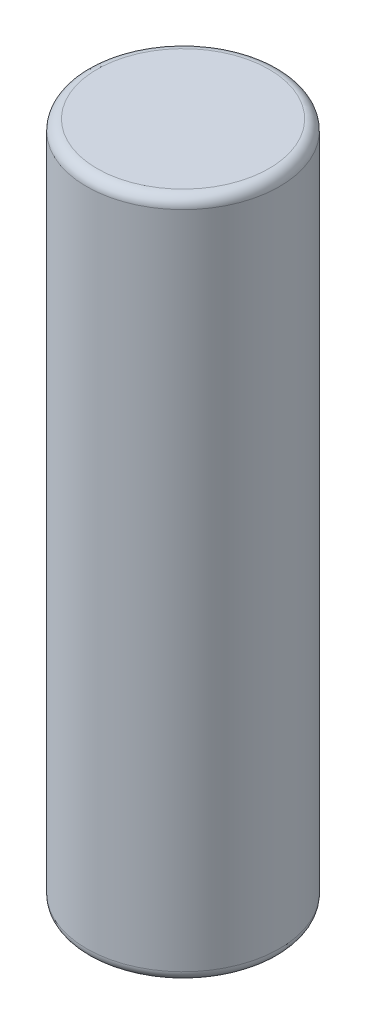
from build123d import *

# Parameters (mm, degrees)
SKETCH_1_R      = 9.25
EXTRUDE_1_DEPTH = 32.65
FILLET_1_R      = 1


with BuildPart() as part:
    # 스케치1 → 보스-돌출1 (new, symmetric)
    with BuildSketch(Plane(origin=(0, 0, 0), x_dir=(1, 0, 0), z_dir=(0, 1, 0))):
        Circle(SKETCH_1_R)
    extrude(amount=EXTRUDE_1_DEPTH, both=True)

    # 필렛1
    fillet_1_edges = [part.edges().sort_by_distance(p)[0] for p in [
        (-9.25, -32.65, 0),
        (-9.25, 32.65, 0),
    ]]
    fillet(fillet_1_edges, radius=FILLET_1_R)


solid = part.part
